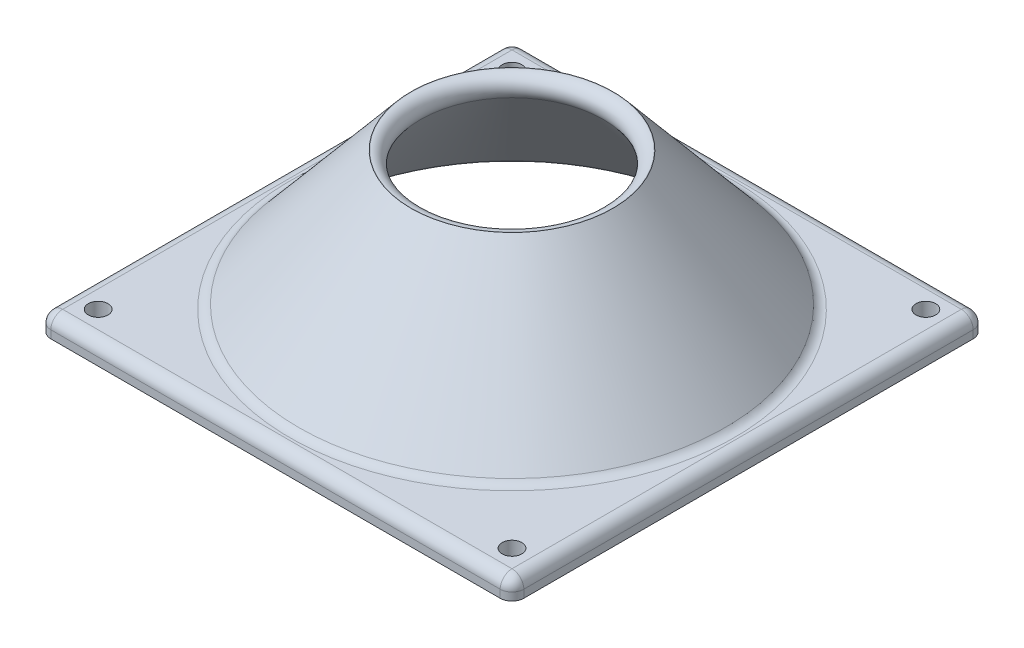
from build123d import *

# Parameters (mm, degrees)
SKETCH1_W           = 120
SKETCH1_H           = 120
SKETCH1_R           = 2.5
BOSS_EXTRUDE1_DEPTH = 5
SKETCH2_R           = 55
BOSS_EXTRUDE2_DEPTH = 35
BOSS_EXTRUDE2_TAPER = 40
FILLET1_R           = 3
FILLET2_R           = 3
FILLET3_R           = 3


# Read off the part's stored shape, not the designer's step: Shell1
with BuildPart() as part:
    # Sketch1 → Boss-Extrude1 (new body)
    with BuildSketch(Plane(origin=(0, 0, 0), x_dir=(1, 0, 0), z_dir=(0, 1, 0))):
        Rectangle(SKETCH1_W, SKETCH1_H)
        with Locations(Location((-52.5, 52.5, 0), (0, 0, 270))):
            Circle(SKETCH1_R, mode=Mode.SUBTRACT)
        with Locations(Location((52.5, 52.5, 0), (0, 0, 270))):
            Circle(SKETCH1_R, mode=Mode.SUBTRACT)
        with Locations(Location((52.5, -52.5, 0), (0, 0, 270))):
            Circle(SKETCH1_R, mode=Mode.SUBTRACT)
        with Locations(Location((-52.5, -52.5, 0), (0, 0, 270))):
            Circle(SKETCH1_R, mode=Mode.SUBTRACT)
    extrude(amount=BOSS_EXTRUDE1_DEPTH)

    # Sketch2 → Boss-Extrude2 (add)
    with BuildSketch(Plane(origin=(0, 5, 0), x_dir=(1, 0, 0), z_dir=(0, 1, 0))):
        Circle(SKETCH2_R)
    extrude(amount=BOSS_EXTRUDE2_DEPTH, taper=BOSS_EXTRUDE2_TAPER)

    # Shell1 outline → Shell1 (revolve, cut)
    with BuildSketch(Plane.XY):
        Polygon((0, 0), (52.668461709, 0), (19.104476462, 40), (0, 40), align=None)
    revolve(axis=Axis((0, 0, 0), (0, 1, 0)), mode=Mode.SUBTRACT)

    # Fillet1
    fillet1_edges = [part.edges().sort_by_distance(p)[0] for p in [
        (-55, 5, 0),
        (-19.104476462, 40, 0),
    ]]
    fillet(fillet1_edges, radius=FILLET1_R)

    # Fillet2
    fillet2_edges = [part.edges().sort_by_distance(p)[0] for p in [
        (-52.668461709, 0, 0),
    ]]
    fillet(fillet2_edges, radius=FILLET2_R)

    # Fillet3
    fillet3_edges = [part.edges().sort_by_distance(p)[0] for p in [
        (-60, 5, 0),
        (0, 5, 60),
        (60, 5, 0),
        (60, 2.5, 60),
        (-60, 2.5, 60),
        (-60, 2.5, -60),
        (60, 2.5, -60),
        (0, 5, -60),
    ]]
    fillet(fillet3_edges, radius=FILLET3_R)


solid = part.part
